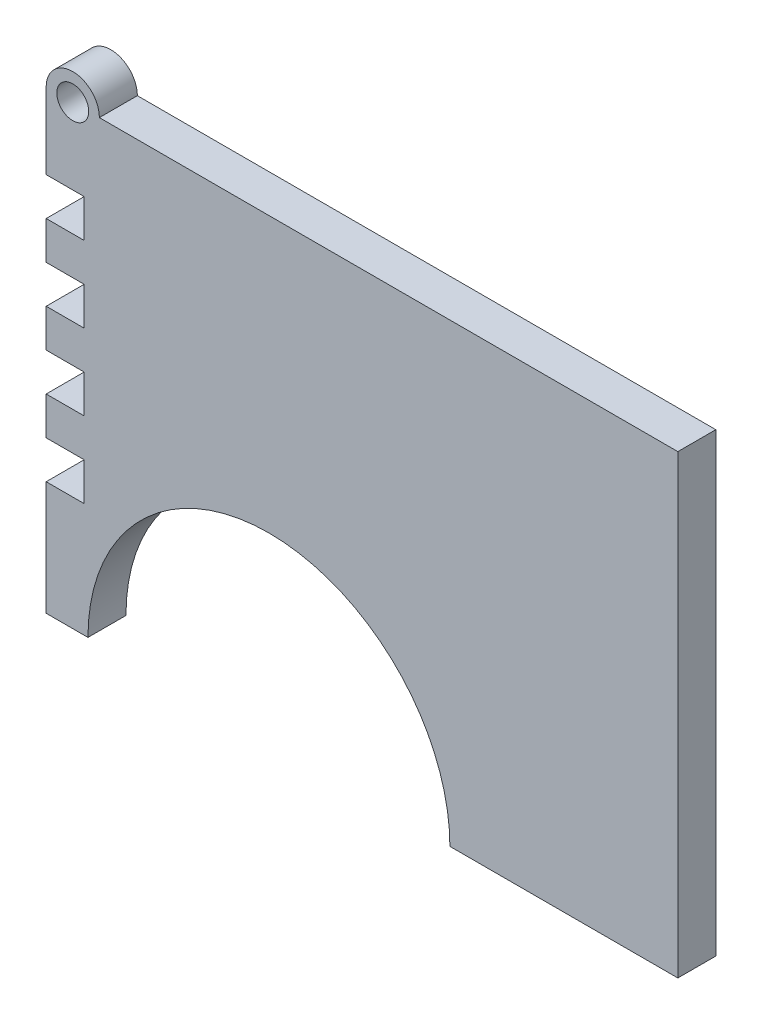
from build123d import *

# Parameters (mm, degrees)
ESQUISSE1_R        = 2.1
BOSS_EXTRU_1_DEPTH = 5


with BuildPart() as part:
    # Esquisse1 → Boss.-Extru.1 (new body)
    with BuildSketch(Plane.XY):
        with BuildLine():
            Line((-78.135883383, 18.842375861), (-83.135883383, 18.842375861))
            Line((-83.135883383, 18.842375861), (-83.135883383, 28.842375861))
            ThreePointArc((-83.135883383, 28.842375861), (-79.635883383, 32.342375861), (-76.135883383, 28.842375861))
            Line((-76.135883383, 28.842375861), (0, 28.842375861))
            Line((0, 28.842375861), (0, 13.842375861))
            Line((0, 13.842375861), (0, -31.157624139))
            Line((0, -31.157624139), (-30, -31.157624139))
            ThreePointArc((-30, -31.157624139), (-53.817941691, -7.339682448), (-77.635883383, -31.157624139))
            Line((-77.635883383, -31.157624139), (-83.135883383, -31.157624139))
            Line((-83.135883383, -31.157624139), (-83.135883383, -16.157624139))
            Line((-83.135883383, -16.157624139), (-78.135883383, -16.157624139))
            Line((-78.135883383, -16.157624139), (-78.135883383, -11.157624139))
            Line((-78.135883383, -11.157624139), (-83.135883383, -11.157624139))
            Line((-83.135883383, -11.157624139), (-83.135883383, -6.157624139))
            Line((-83.135883383, -6.157624139), (-78.135883383, -6.157624139))
            Line((-78.135883383, -6.157624139), (-78.135883383, -1.157624139))
            Line((-78.135883383, -1.157624139), (-83.135883383, -1.157624139))
            Line((-83.135883383, -1.157624139), (-83.135883383, 3.842375861))
            Line((-83.135883383, 3.842375861), (-78.135883383, 3.842375861))
            Line((-78.135883383, 3.842375861), (-78.135883383, 8.842375861))
            Line((-78.135883383, 8.842375861), (-83.135883383, 8.842375861))
            Line((-83.135883383, 8.842375861), (-83.135883383, 13.842375861))
            Line((-83.135883383, 13.842375861), (-78.135883383, 13.842375861))
            Line((-78.135883383, 13.842375861), (-78.135883383, 18.842375861))
        make_face()
        with Locations((-79.635883383, 28.842375861)):
            Circle(ESQUISSE1_R, mode=Mode.SUBTRACT)
    extrude(amount=BOSS_EXTRU_1_DEPTH)


solid = part.part
